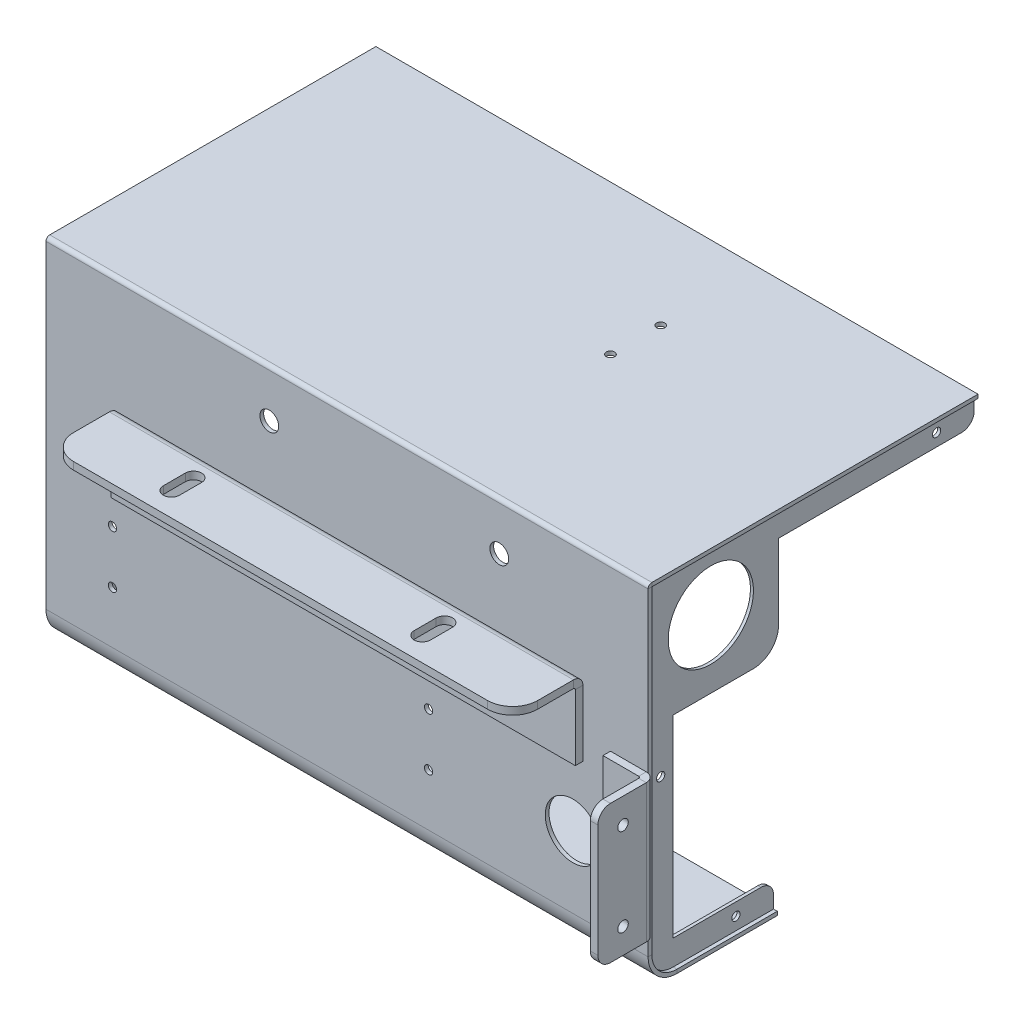
from build123d import *

# Parameters (mm, degrees)
SKETCH_1_W                       = 240
SKETCH_1_H                       = 140
SM_BASE_FLANGE_1_DEPTH           = 1.5
SM_START                         = -120
SM_EDGE_FLANGE_1_DEPTH           = 240
SM_EDGE_FLANGE_1_2_OUTLINE_W     = 1.5
SM_EDGE_FLANGE_1_2_OUTLINE_H     = 130
SM_EDGE_FLANGE_1_2_DEPTH         = 240
SM_EDGE_FLANGE_2_STRIP_W         = 26
SM_EDGE_FLANGE_2_STRIP_H         = 1.5
SM_EDGE_FLANGE_2_STRIP_CUT_DEPTH = 240
SM_EDGE_FLANGE_2_DEPTH           = 240
EXTRUDE_START                    = -1.5
SKETCH_10_W                      = 52
SKETCH_10_H                      = 50
EXTRUDE_1_DEPTH                  = 1.2
SKETCH_11_R                      = 17
CUT_EXTRUDE_7_DEPTH              = 5
SKETCH_12_R                      = 11
CUT_EXTRUDE_8_DEPTH              = 5
EXTRUDE_2_DEPTH                  = 1.2
EXTRUDE_3_DEPTH                  = 1.2
SKETCH_16_W                      = 42
SKETCH_16_H                      = 40
CUT_EXTRUDE_9_DEPTH              = 1.2
HOLE_WIZARD_M4_1_AT_2_COUNT      = 2
HOLE_WIZARD_M4_1_AT_2_PITCH      = 127.163044946
HOLE_WIZARD_M4_1_AT_3_COUNT      = 2
HOLE_WIZARD_M4_1_AT_3_PITCH      = 150.096635539
SKETCH_19_W                      = 185
SKETCH_19_H                      = 30
SM_BASE_FLANGE_1_2_DEPTH         = 3
SM_EDGE_FLANGE_3_STRIP_W         = 13.4732
SM_EDGE_FLANGE_3_STRIP_H         = 3
SM_EDGE_FLANGE_3_STRIP_CUT_DEPTH = 185
SM_EDGE_FLANGE_3_DEPTH           = 185
FILLET_1_R                       = 10
CUT_EXTRUDE_10_DEPTH             = 5
SKETCH_25_R                      = 3.75
CUT_EXTRUDE_11_DEPTH             = 10
EXTRUDE_1_2_DEPTH                = 6
HOLE_WIZARD_M4_2_AT_2_COUNT      = 2
HOLE_WIZARD_M4_2_AT_2_PITCH      = 21
HOLE_WIZARD_M4_2_AT_3_COUNT      = 2
HOLE_WIZARD_M4_2_AT_3_PITCH      = 126
HOLE_WIZARD_M4_2_AT_4_COUNT      = 2
HOLE_WIZARD_M4_2_AT_4_PITCH      = 127.738013136
SKETCH_29_W                      = 15
SKETCH_29_H                      = 55
SM_BASE_FLANGE_2_DEPTH           = 3
SM_EDGE_FLANGE_4_STRIP_W         = 13.4732
SM_EDGE_FLANGE_4_STRIP_H         = 3
SM_EDGE_FLANGE_4_STRIP_CUT_DEPTH = 55
SM_EDGE_FLANGE_4_DEPTH           = 55
HOLE_WIZARD_M5_1_AT_2_COUNT      = 2
HOLE_WIZARD_M5_1_AT_2_PITCH      = 35
FILLET_2_R                       = 5
FILLET_3_R                       = 10
HOLE_WIZARD_M4_3_AT_2_COUNT      = 2
HOLE_WIZARD_M4_3_AT_2_PITCH      = 20


# Read off the part's stored shape, not the designer's step: 边线-法兰1, 拉伸-薄壁1
# Sheet-metal steps are written as plain solids
with BuildPart() as part:
    # Sketch 1 → Sm Base Flange 1 (new body)
    with BuildSketch(Plane.XY):
        Rectangle(SKETCH_1_W, SKETCH_1_H)
    extrude(amount=-SM_BASE_FLANGE_1_DEPTH)

    # 边线-法兰1 outline → 边线-法兰1 (cut)
    with BuildSketch(Plane.YZ.offset(SM_START)):
        with BuildLine():
            Line((70, 0), (68.5, 0))
            ThreePointArc((68.5, 0), (69.560660172, -0.439339828), (70, -1.5))
            Line((70, -1.5), (70, 0))
        make_face()
    extrude(amount=SM_EDGE_FLANGE_1_DEPTH, mode=Mode.SUBTRACT)

    # Sm Edge Flange 1 2 outline → Sm Edge Flange 1 2 (add)
    with BuildSketch(Plane.YZ.offset(SM_START)):
        with Locations((69.25, -66.5)):
            Rectangle(SM_EDGE_FLANGE_1_2_OUTLINE_W, SM_EDGE_FLANGE_1_2_OUTLINE_H)
    extrude(amount=SM_EDGE_FLANGE_1_2_DEPTH)

    # 边线-法兰2 strip (across the edge) → 边线-法兰2 strip cut (cut)
    with BuildSketch(Plane(origin=(120, -70, -1.5), x_dir=(0, 1, 0), z_dir=(-1, 0, 0))):
        with Locations((-1.5, -0.75)):
            Rectangle(SM_EDGE_FLANGE_2_STRIP_W, SM_EDGE_FLANGE_2_STRIP_H)
    extrude(amount=SM_EDGE_FLANGE_2_STRIP_CUT_DEPTH, mode=Mode.SUBTRACT)

    # 边线-法兰2 section (across the edge) → 边线-法兰2 (add)
    with BuildSketch(Plane(origin=(120, -70, -1.5), x_dir=(0, 1, 0), z_dir=(-1, 0, 0))):
        with BuildLine():
            Line((0, 10), (0, 50))
            Line((0, 50), (1.5, 50))
            Line((1.5, 50), (1.5, 10))
            ThreePointArc((1.5, 10), (4.428932188, 2.928932188), (11.5, 0))
            Line((11.5, 0), (11.5, -1.5))
            ThreePointArc((11.5, -1.5), (3.368272016, 1.868272016), (0, 10))
        make_face()
    extrude(amount=SM_EDGE_FLANGE_2_DEPTH)

    # 草图10 → Extrude 1 (add)
    with BuildSketch(Plane(origin=(120, 0, 0), x_dir=(0, 0, -1), z_dir=(1, 0, 0)).offset(EXTRUDE_START)):
        with Locations((27.5, 43.5)):
            Rectangle(SKETCH_10_W, SKETCH_10_H)
    extrude_1 = extrude(amount=-EXTRUDE_1_DEPTH)

    # 草图11 → 切除-拉伸7 (cut)
    with BuildSketch(Plane(origin=(118.5, 0, 0), x_dir=(0, 0, -1), z_dir=(1, 0, 0))):
        with Locations((26.5, 45.5)):
            Circle(SKETCH_11_R)
    extrude(amount=-CUT_EXTRUDE_7_DEPTH, mode=Mode.SUBTRACT)

    # 草图12 → 切除-拉伸8 (cut)
    with BuildSketch(Plane(origin=(0, 0, -1.5), x_dir=(-1, 0, 0), z_dir=(0, 0, -1))):
        with Locations((-90, -30)):
            Circle(SKETCH_12_R)
    extrude(amount=-CUT_EXTRUDE_8_DEPTH, mode=Mode.SUBTRACT)

    # 草图14 → 凸台-拉伸2 (add)
    with BuildSketch(Plane(origin=(120, 0, 0), x_dir=(0, 0, -1), z_dir=(1, 0, 0)).offset(EXTRUDE_START)):
        with BuildLine():
            Line((51.5, -68.5), (11.5, -68.5))
            ThreePointArc((11.5, -68.5), (4.428932188, -65.571067812), (1.5, -58.5))
            Line((1.5, -58.5), (1.5, 18.5))
            Line((1.5, 18.5), (11.5, 18.5))
            Line((11.5, 18.5), (11.5, -58.5))
            Line((11.5, -58.5), (46.5, -58.5))
            ThreePointArc((46.5, -58.5), (50.035533906, -59.964466094), (51.5, -63.5))
            Line((51.5, -63.5), (51.5, -68.5))
        make_face()
    extrude_2 = extrude(amount=-EXTRUDE_2_DEPTH)

    # 草图15 → 凸台-拉伸3 (add)
    with BuildSketch(Plane(origin=(120, 0, 0), x_dir=(0, 0, -1), z_dir=(1, 0, 0)).offset(EXTRUDE_START)):
        with BuildLine():
            Line((53.5, 68.5), (131.5, 68.5))
            Line((131.5, 68.5), (131.5, 63.5))
            ThreePointArc((131.5, 63.5), (130.035533906, 59.964466094), (126.5, 58.5))
            Line((126.5, 58.5), (53.5, 58.5))
            Line((53.5, 58.5), (53.5, 68.5))
        make_face()
    extrude_3 = extrude(amount=-EXTRUDE_3_DEPTH)

    # 镜向1: Extrude 1, 凸台-拉伸2, 凸台-拉伸3 across plane
    add(extrude_1.mirror(Plane(origin=(0, 0, 0), x_dir=(0, 0, 1), z_dir=(1, 0, 0))))
    add(extrude_2.mirror(Plane(origin=(0, 0, 0), x_dir=(0, 0, 1), z_dir=(1, 0, 0))))
    add(extrude_3.mirror(Plane(origin=(0, 0, 0), x_dir=(0, 0, 1), z_dir=(1, 0, 0))))

    # 草图16 → 切除-拉伸9 (cut)
    with BuildSketch(Plane.ZY.offset(118.5)):
        with Locations((-32.5, 38.5)):
            Rectangle(SKETCH_16_W, SKETCH_16_H)
    extrude(amount=-CUT_EXTRUDE_9_DEPTH, mode=Mode.SUBTRACT)

    # 草图17 → M4 螺纹孔1 (revolve, cut)
    with BuildSketch(Plane(origin=(-118.5, 63.5, -116.5), x_dir=(0, 0, 1), z_dir=(0, 1, 0))):
        Polygon((0, 0), (0, 11.091420021), (1.65, 10.1), (1.65, 0), align=None)
    hole_wizard_m4_1 = revolve(axis=Axis((-124.85, 63.5, -116.5), (1, 0, 0)), mode=Mode.SUBTRACT)

    # M4 螺纹孔1 at 2: M4 螺纹孔1 ×2
    with Locations(*[Vector(0, -0.5017180897718436, 0.8650311892618048) * (i * HOLE_WIZARD_M4_1_AT_2_PITCH) for i in range(1, HOLE_WIZARD_M4_1_AT_2_COUNT)]):
        add(hole_wizard_m4_1, mode=Mode.SUBTRACT)

    # M4 螺纹孔1 at 3: M4 螺纹孔1 ×2
    with Locations(*[Vector(0, -0.8461215639131389, 0.532989961520087) * (i * HOLE_WIZARD_M4_1_AT_3_PITCH) for i in range(1, HOLE_WIZARD_M4_1_AT_3_COUNT)]):
        add(hole_wizard_m4_1, mode=Mode.SUBTRACT)

    # 镜向2: M4 螺纹孔1 across plane
    add(hole_wizard_m4_1.mirror(Plane(origin=(0, 0, 0), x_dir=(0, 0, 1), z_dir=(1, 0, 0))), mode=Mode.SUBTRACT)

    # 镜向2 copy 1 sketch → 镜向2 copy 1 (revolve, cut)
    with BuildSketch(Plane(origin=(118.5, -0.3, -6.5), x_dir=(0, 0, 1), z_dir=(0, 1, 0))):
        Polygon((0, 0), (0, -11.091420021), (1.65, -10.1), (1.65, 0), align=None)
    revolve(axis=Axis((124.85, -0.3, -6.5), (1, 0, 0)), mode=Mode.SUBTRACT)

    # 镜向2 copy 2 sketch → 镜向2 copy 2 (revolve, cut)
    with BuildSketch(Plane(origin=(118.5, -63.5, -36.5), x_dir=(0, 0, 1), z_dir=(0, 1, 0))):
        Polygon((0, 0), (0, -11.091420021), (1.65, -10.1), (1.65, 0), align=None)
    revolve(axis=Axis((124.85, -63.5, -36.5), (1, 0, 0)), mode=Mode.SUBTRACT)

    # 草图25 → 切除-拉伸11 (cut)
    with BuildSketch(Plane(origin=(0, 0, -1.5), x_dir=(-1, 0, 0), z_dir=(0, 0, -1))):
        with Locations((-60.681190721, 51)):
            Circle(SKETCH_25_R)
        with Locations((31, 51)):
            Circle(SKETCH_25_R)
    extrude(amount=-CUT_EXTRUDE_11_DEPTH, mode=Mode.SUBTRACT)

    # Extrude 1 2 outline → Extrude 1 2 (add)
    with BuildSketch(Plane(origin=(-117.3, 0, 0), x_dir=(0, 0, -1), z_dir=(1, 0, 0))):
        with BuildLine():
            Line((51.5, -68.5), (51.5, -67))
            Line((51.5, -67), (11.5, -67))
            ThreePointArc((11.5, -67), (5.48959236, -64.51040764), (3, -58.5))
            Line((3, -58.5), (3, 67))
            Line((3, 67), (131.5, 67))
            Line((131.5, 67), (131.5, 68.5))
            Line((131.5, 68.5), (1.5, 68.5))
            Line((1.5, 68.5), (1.5, -58.5))
            ThreePointArc((1.5, -58.5), (4.428932188, -65.571067812), (11.5, -68.5))
            Line((11.5, -68.5), (51.5, -68.5))
        make_face()
    extrude_1_2 = extrude(amount=EXTRUDE_1_2_DEPTH)

    # 镜向3: Extrude 1 2 across plane
    add(extrude_1_2.mirror(Plane(origin=(0, 0, 0), x_dir=(0, 0, 1), z_dir=(1, 0, 0))))

    # 草图27 → M4 螺纹孔2 (revolve, cut)
    with BuildSketch(Plane(origin=(-93.5, -16.7, -1.5), x_dir=(0, 1, 0), z_dir=(1, 0, 0))):
        Polygon((0, 0), (0, 11.091420021), (1.65, 10.1), (1.65, 0), align=None)
    hole_wizard_m4_2 = revolve(axis=Axis((-93.5, -16.7, -7.85), (0, 0, 1)), mode=Mode.SUBTRACT)

    # M4 螺纹孔2 at 2: M4 螺纹孔2 ×2
    with Locations(*[(0, -i * HOLE_WIZARD_M4_2_AT_2_PITCH, 0) for i in range(1, HOLE_WIZARD_M4_2_AT_2_COUNT)]):
        add(hole_wizard_m4_2, mode=Mode.SUBTRACT)

    # M4 螺纹孔2 at 3: M4 螺纹孔2 ×2
    with Locations(*[(i * HOLE_WIZARD_M4_2_AT_3_PITCH, 0, 0) for i in range(1, HOLE_WIZARD_M4_2_AT_3_COUNT)]):
        add(hole_wizard_m4_2, mode=Mode.SUBTRACT)

    # M4 螺纹孔2 at 4: M4 螺纹孔2 ×2
    with Locations(*[Vector(0.9863939238321437, -0.16439898730535732, 0) * (i * HOLE_WIZARD_M4_2_AT_4_PITCH) for i in range(1, HOLE_WIZARD_M4_2_AT_4_COUNT)]):
        add(hole_wizard_m4_2, mode=Mode.SUBTRACT)

    # 圆角3
    fillet_3_edges = [part.edges().sort_by_distance(p)[0] for p in [
        (117.9, 18.5, -53.5),
    ]]
    fillet(fillet_3_edges, radius=FILLET_3_R)

    # 草图37 → M4 螺纹孔3 (revolve, cut)
    with BuildSketch(Plane(origin=(33, 68.5, -92), x_dir=(0, 0, -1), z_dir=(1, 0, 0))):
        Polygon((0, 0), (0, 11.091420021), (1.65, 10.1), (1.65, 0), align=None)
    hole_wizard_m4_3 = revolve(axis=Axis((33, 62.15, -92), (0, 1, 0)), mode=Mode.SUBTRACT)

    # M4 螺纹孔3 at 2: M4 螺纹孔3 ×2
    with Locations(*[(0, 0, i * HOLE_WIZARD_M4_3_AT_2_PITCH) for i in range(1, HOLE_WIZARD_M4_3_AT_2_COUNT)]):
        add(hole_wizard_m4_3, mode=Mode.SUBTRACT)


with BuildPart() as body_2:
    # 草图19 → Sm Base Flange 1 2 (new body)
    with BuildSketch(Plane.XY):
        with Locations((1.5, 11)):
            Rectangle(SKETCH_19_W, SKETCH_19_H)
    extrude(amount=SM_BASE_FLANGE_1_2_DEPTH)

    # 边线-法兰3 strip (across the edge) → 边线-法兰3 strip cut (cut)
    with BuildSketch(Plane(origin=(94, 26, 3), x_dir=(0, -1, 0), z_dir=(-1, 0, 0))):
        with Locations((-3, -1.5)):
            Rectangle(SM_EDGE_FLANGE_3_STRIP_W, SM_EDGE_FLANGE_3_STRIP_H)
    extrude(amount=SM_EDGE_FLANGE_3_STRIP_CUT_DEPTH, mode=Mode.SUBTRACT)

    # 边线-法兰3 section (across the edge) → 边线-法兰3 (add)
    with BuildSketch(Plane(origin=(94, 26, 3), x_dir=(0, -1, 0), z_dir=(-1, 0, 0))):
        with BuildLine():
            Line((0, 0.7366), (0, 25))
            Line((0, 25), (3, 25))
            Line((3, 25), (3, 0.7366))
            ThreePointArc((3, 0.7366), (3.215745145, 0.215745145), (3.7366, 0))
            Line((3.7366, 0), (3.7366, -3))
            ThreePointArc((3.7366, -3), (1.094424801, -1.905575199), (0, 0.7366))
        make_face()
    extrude(amount=SM_EDGE_FLANGE_3_DEPTH)

    # 圆角1
    fillet_1_edges = [body_2.edges().sort_by_distance(p)[0] for p in [
        (94, 24.5, 28),
        (-91, 24.5, 28),
    ]]
    fillet(fillet_1_edges, radius=FILLET_1_R)

    # 草图24 → 切除-拉伸10 (cut)
    with BuildSketch(Plane.XZ.offset(-23)):
        with BuildLine():
            Line((51.75, 18.49495535), (51.75, 9.701048726))
            ThreePointArc((51.75, 9.701048726), (48.5, 6.451048726), (45.25, 9.701048726))
            Line((45.25, 9.701048726), (45.25, 18.49495535))
            ThreePointArc((45.25, 18.49495535), (48.5, 21.74495535), (51.75, 18.49495535))
        make_face()
        with BuildLine():
            Line((-54.75, 9.701048726), (-54.75, 18.49495535))
            ThreePointArc((-54.75, 18.49495535), (-51.5, 21.74495535), (-48.25, 18.49495535))
            Line((-48.25, 18.49495535), (-48.25, 9.701048726))
            ThreePointArc((-48.25, 9.701048726), (-51.5, 6.451048726), (-54.75, 9.701048726))
        make_face()
    extrude(amount=-CUT_EXTRUDE_10_DEPTH, mode=Mode.SUBTRACT)


with BuildPart() as body_3:
    # 草图29 → 薄片2 (new body)
    with BuildSketch(Plane.XY):
        with Locations((112.5, -22.5)):
            Rectangle(SKETCH_29_W, SKETCH_29_H)
    extrude(amount=SM_BASE_FLANGE_2_DEPTH)

    # 边线-法兰4 strip (across the edge) → 边线-法兰4 strip cut (cut)
    with BuildSketch(Plane(origin=(120, -50, 3), x_dir=(-1, 0, 0), z_dir=(0, 1, 0))):
        with Locations((-6, -1.5)):
            Rectangle(SM_EDGE_FLANGE_4_STRIP_W, SM_EDGE_FLANGE_4_STRIP_H)
    extrude(amount=SM_EDGE_FLANGE_4_STRIP_CUT_DEPTH, mode=Mode.SUBTRACT)

    # 边线-法兰4 section (across the edge) → 边线-法兰4 (add)
    with BuildSketch(Plane(origin=(120, -50, 3), x_dir=(-1, 0, 0), z_dir=(0, 1, 0))):
        with BuildLine():
            Line((-3, 0.7366), (-3, 20))
            Line((-3, 20), (0, 20))
            Line((0, 20), (0, 0.7366))
            ThreePointArc((0, 0.7366), (0.215745145, 0.215745145), (0.7366, 0))
            Line((0.7366, 0), (0.7366, -3))
            ThreePointArc((0.7366, -3), (-1.905575199, -1.905575199), (-3, 0.7366))
        make_face()
    extrude(amount=SM_EDGE_FLANGE_4_DEPTH)

    # 草图35 → M5 螺纹孔1 (revolve, cut)
    with BuildSketch(Plane(origin=(123, -5, 13), x_dir=(0, 0, -1), z_dir=(0, 1, 0))):
        Polygon((0, 0), (0, 13.6618073), (2.1, 12.4), (2.1, 0), align=None)
    hole_wizard_m5_1 = revolve(axis=Axis((129.35, -5, 13), (-1, 0, 0)), mode=Mode.SUBTRACT)

    # M5 螺纹孔1 at 2: M5 螺纹孔1 ×2
    with Locations(*[(0, -i * HOLE_WIZARD_M5_1_AT_2_PITCH, 0) for i in range(1, HOLE_WIZARD_M5_1_AT_2_COUNT)]):
        add(hole_wizard_m5_1, mode=Mode.SUBTRACT)

    # 圆角2
    fillet_2_edges = [body_3.edges().sort_by_distance(p)[0] for p in [
        (121.5, -50, 23),
        (121.5, 5, 23),
    ]]
    fillet(fillet_2_edges, radius=FILLET_2_R)


solid = Compound([part.part, body_2.part, body_3.part])
